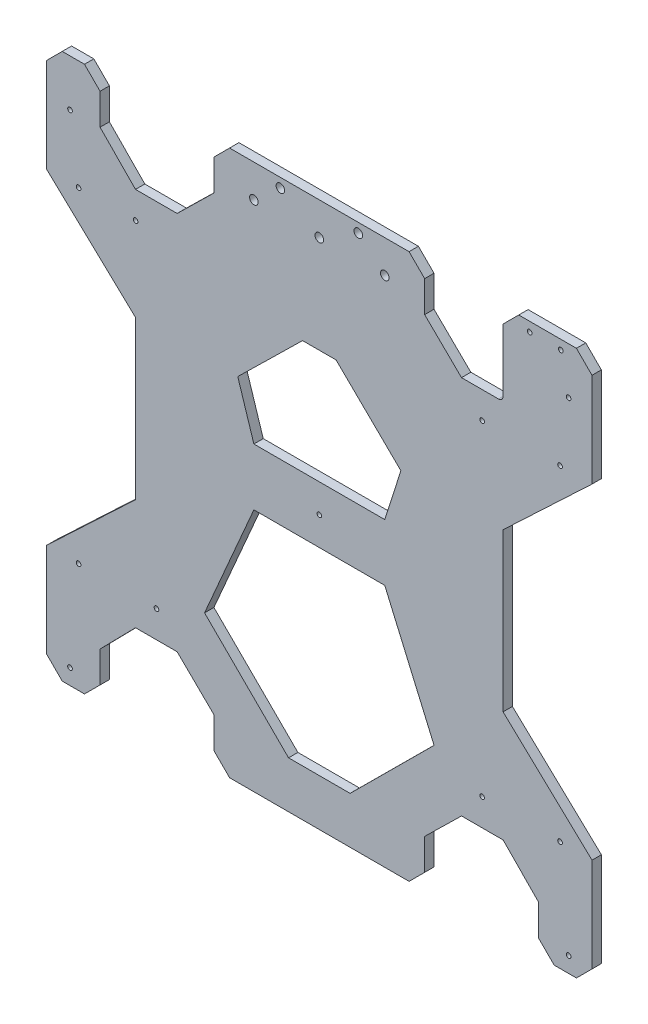
from build123d import *

# Parameters (mm, degrees)
SCHIZZO13_R                  = 1.5
SCHIZZO13_R_2                = 2.75
ESTRUSIONE_ESTRUSIONE2_DEPTH = 6


with BuildPart() as part:
    # Schizzo13 → Estrusione-Estrusione2 (new body)
    with BuildSketch(Plane.XY):
        with BuildLine():
            Line((10, 0), (24.28195797, 0))
            Line((24.28195797, 0), (34.28195797, 10))
            Line((34.28195797, 10), (34.28195797, 30))
            Line((34.28195797, 30), (57.017366293, 53.192694567))
            Line((57.017366293, 53.192694567), (83.745372993, 53.192694567))
            Line((83.745372993, 53.192694567), (107.404551383, 30))
            Line((107.404551383, 30), (107.404551383, 10))
            Line((107.404551383, 10), (117.404551383, 0))
            Line((117.404551383, 0), (232.595448617, 0))
            Line((232.595448617, 0), (242.595448617, 10))
            Line((242.595448617, 10), (242.595448617, 30))
            Line((242.595448617, 30), (266.254627007, 53.192694567))
            Line((266.254627007, 53.192694567), (292.982633707, 53.192694567))
            Line((292.982633707, 53.192694567), (315.71804203, 30))
            Line((315.71804203, 30), (315.71804203, 10))
            Line((315.71804203, 10), (325.71804203, 0))
            Line((325.71804203, 0), (340, 0))
            Line((340, 0), (350, 10))
            Line((350, 10), (350, 70.5))
            Line((350, 70.5), (292.919241786, 124.388863529))
            Line((292.919241786, 124.388863529), (292.919241786, 225.611136471))
            Line((292.919241786, 225.611136471), (350, 279.5))
            Line((350, 279.5), (350, 340))
            Line((350, 340), (340, 350))
            Line((340, 350), (302.982633707, 350))
            Line((302.982633707, 350), (292.982633707, 340))
            Line((292.982633707, 340), (292.982633707, 299.807305433))
            ThreePointArc((292.982633707, 299.807305433), (292.103954051, 297.685985089), (289.982633707, 296.807305433))
            Line((289.982633707, 296.807305433), (266.254627007, 296.807305433))
            Line((266.254627007, 296.807305433), (242.595448617, 320))
            Line((242.595448617, 320), (242.595448617, 340))
            Line((242.595448617, 340), (232.595448617, 350))
            Line((232.595448617, 350), (117.404551383, 350))
            Line((117.404551383, 350), (107.404551383, 340))
            Line((107.404551383, 340), (107.404551383, 320))
            Line((107.404551383, 320), (83.745372993, 296.807305433))
            Line((83.745372993, 296.807305433), (57.017366293, 296.807305433))
            Line((57.017366293, 296.807305433), (34.28195797, 320))
            Line((34.28195797, 320), (34.28195797, 340))
            Line((34.28195797, 340), (24.28195797, 350))
            Line((24.28195797, 350), (10, 350))
            Line((10, 350), (0, 340))
            Line((0, 340), (0, 279.5))
            Line((0, 279.5), (57.080758214, 225.611136471))
            Line((57.080758214, 225.611136471), (57.080758214, 175))
            Line((57.080758214, 175), (57.080758214, 124.388863529))
            Line((57.080758214, 124.388863529), (0, 70.5))
            Line((0, 70.5), (0, 10))
            Line((0, 10), (10, 0))
        make_face()
        with Locations((15, 320)):
            Circle(SCHIZZO13_R, mode=Mode.SUBTRACT)
        with Locations((20.5, 279.5)):
            Circle(SCHIZZO13_R, mode=Mode.SUBTRACT)
        with Locations((57.080758214, 279.5)):
            Circle(SCHIZZO13_R, mode=Mode.SUBTRACT)
        with Locations((175, 175)):
            Circle(SCHIZZO13_R, mode=Mode.SUBTRACT)
        with Locations((20.5, 70.5)):
            Circle(SCHIZZO13_R, mode=Mode.SUBTRACT)
        with Locations((200, 344)):
            Circle(SCHIZZO13_R_2, mode=Mode.SUBTRACT)
        with Locations((150, 344)):
            Circle(SCHIZZO13_R_2, mode=Mode.SUBTRACT)
        with Locations((175, 329)):
            Circle(SCHIZZO13_R_2, mode=Mode.SUBTRACT)
        with Locations((217, 329)):
            Circle(SCHIZZO13_R_2, mode=Mode.SUBTRACT)
        with Locations((133, 329)):
            Circle(SCHIZZO13_R_2, mode=Mode.SUBTRACT)
        with Locations((70.5, 70.5)):
            Circle(SCHIZZO13_R, mode=Mode.SUBTRACT)
        with Locations((279.5, 70.5)):
            Circle(SCHIZZO13_R, mode=Mode.SUBTRACT)
        with Locations((329.5, 70.5)):
            Circle(SCHIZZO13_R, mode=Mode.SUBTRACT)
        with Locations((335, 10)):
            Circle(SCHIZZO13_R, mode=Mode.SUBTRACT)
        with Locations((15, 10)):
            Circle(SCHIZZO13_R, mode=Mode.SUBTRACT)
        with Locations((279.5, 279.5)):
            Circle(SCHIZZO13_R, mode=Mode.SUBTRACT)
        with Locations((329.5, 279.5)):
            Circle(SCHIZZO13_R, mode=Mode.SUBTRACT)
        with Locations((335, 320)):
            Circle(SCHIZZO13_R, mode=Mode.SUBTRACT)
        with Locations((310, 344)):
            Circle(SCHIZZO13_R, mode=Mode.SUBTRACT)
        with Locations((330, 344)):
            Circle(SCHIZZO13_R, mode=Mode.SUBTRACT)
        Polygon((217, 193.286910978), (227.343033378, 225.611136471), (185.750894453, 266.383210572), (164.249105547, 266.383210572), (122.656966622, 225.611136471), (133, 193.286910978), align=None, mode=Mode.SUBTRACT)
        Polygon((133, 156.713089022), (101.348199345, 83.616789428), (155.254193112, 30), (194.745806888, 30), (248.651800655, 83.616789428), (217, 156.713089022), align=None, mode=Mode.SUBTRACT)
    extrude(amount=-ESTRUSIONE_ESTRUSIONE2_DEPTH)


solid = part.part
